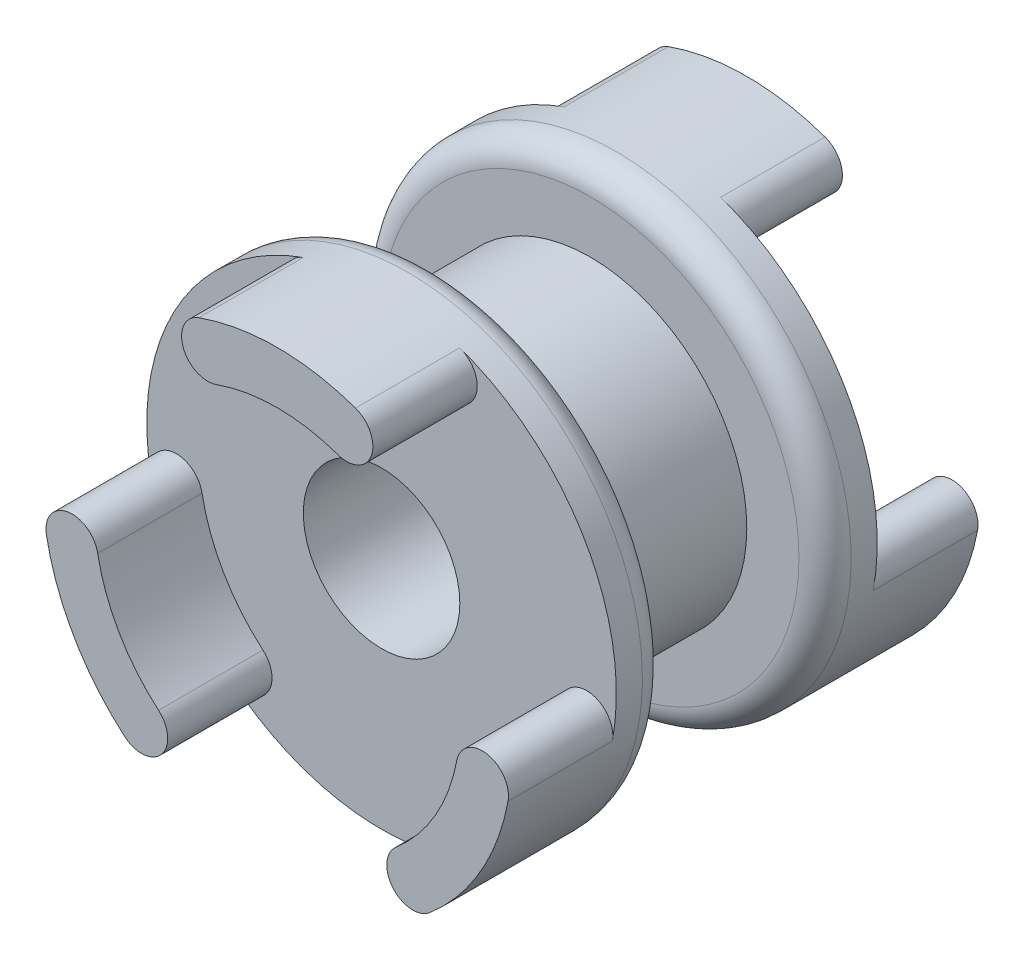
from build123d import *
from build123d.topology import SkipClean

# Parameters (mm, degrees)
FILLET2_R            = 1
BOSS_EXTRUDE1_DEPTH  = 4
CIRPATTERN1_COUNT    = 3
MIRROR1_COPY_1_DEPTH = 4
MIRROR1_COPY_2_DEPTH = 4
MIRROR1_COPY_3_DEPTH = 4


with BuildPart() as part:
    # Sketch2 → Revolve1 (revolve)
    with BuildSketch(Plane(origin=(0, 0, 0), x_dir=(0, 0, -1), z_dir=(1, 0, 0))):
        Polygon((-5, 9), (-5, 3), (5, 3), (5, 9), (3, 9), (3, 6), (-3, 6), (-3, 9), align=None)
    revolve(axis=Axis((0, 0, 0), (0, 0, -1)))

    # Fillet2
    fillet2_edges = [part.edges().sort_by_distance(p)[0] for p in [
        (0, -9, -3),
        (0, -9, 3),
    ]]
    fillet(fillet2_edges, radius=FILLET2_R)

    # Sketch3 → Boss-Extrude1 (add)
    with BuildSketch(Plane(origin=(0, 0, -5), x_dir=(-1, 0, 0), z_dir=(0, 0, -1))):
        with BuildLine():
            ThreePointArc((3, 8.485281374), (0, 9), (-3, 8.485281374))
            ThreePointArc((-3, 8.485281374), (-3.609475708, 7.209138999), (-2.333333333, 6.599663291))
            ThreePointArc((-2.333333333, 6.599663291), (0, 7), (2.333333333, 6.599663291))
            ThreePointArc((2.333333333, 6.599663291), (3.609475708, 7.209138999), (3, 8.485281374))
        make_face()
    boss_extrude1 = extrude(amount=BOSS_EXTRUDE1_DEPTH)

    # CirPattern1: Boss-Extrude1 ×3 about axis
    cirpattern1_axis = Axis((0, 0, -5), (0, 0, 1))
    for i in range(1, CIRPATTERN1_COUNT):
        add(boss_extrude1.rotate(cirpattern1_axis, i * 360 / CIRPATTERN1_COUNT))

    # Mirror1 copy 1 sketch → Mirror1 copy 1 (add)
    with BuildSketch(Plane(origin=(0, 0, 5), x_dir=(0.4999999999999998, -0.8660254037844387, 0), z_dir=(0, 0, 1))):
        with BuildLine():
            ThreePointArc((3, -8.485281374), (0, -9), (-3, -8.485281374))
            ThreePointArc((-3, -8.485281374), (-3.609475708, -7.209138999), (-2.333333333, -6.599663291))
            ThreePointArc((-2.333333333, -6.599663291), (0, -7), (2.333333333, -6.599663291))
            ThreePointArc((2.333333333, -6.599663291), (3.609475708, -7.209138999), (3, -8.485281374))
        make_face()
    extrude(amount=MIRROR1_COPY_1_DEPTH)

    # Mirror1 copy 2 sketch → Mirror1 copy 2 (add)
    with BuildSketch(Plane(origin=(0, 0, 5), x_dir=(0.5000000000000004, 0.8660254037844384, 0), z_dir=(0, 0, 1))):
        with BuildLine():
            ThreePointArc((3, -8.485281374), (0, -9), (-3, -8.485281374))
            ThreePointArc((-3, -8.485281374), (-3.609475708, -7.209138999), (-2.333333333, -6.599663291))
            ThreePointArc((-2.333333333, -6.599663291), (0, -7), (2.333333333, -6.599663291))
            ThreePointArc((2.333333333, -6.599663291), (3.609475708, -7.209138999), (3, -8.485281374))
        make_face()
    extrude(amount=MIRROR1_COPY_2_DEPTH)

    # Mirror1 copy 3 sketch → Mirror1 copy 3 (add)
    with SkipClean():  # the faces are left unmerged after this step: merging them gives an invalid solid
        with BuildSketch(Plane(origin=(0, 0, 5), x_dir=(-1, 0, 0), z_dir=(0, 0, 1))):
            with BuildLine():
                ThreePointArc((3, -8.485281374), (0, -9), (-3, -8.485281374))
                ThreePointArc((-3, -8.485281374), (-3.609475708, -7.209138999), (-2.333333333, -6.599663291))
                ThreePointArc((-2.333333333, -6.599663291), (0, -7), (2.333333333, -6.599663291))
                ThreePointArc((2.333333333, -6.599663291), (3.609475708, -7.209138999), (3, -8.485281374))
            make_face()
        extrude(amount=MIRROR1_COPY_3_DEPTH)


solid = part.part
